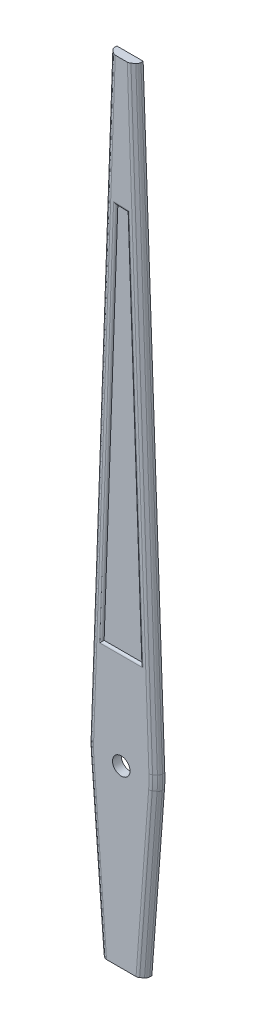
from build123d import *
from OCP.BRepFilletAPI import BRepFilletAPI_MakeChamfer

# Parameters (mm, degrees)
SKETCH_1_R          = 0.2
EXTRUDE_1_DEPTH     = 0.2
CHAMFER_1_SIZE      = 0.1
CHAMFER_1_SIZE2     = 0.127994163
CUT_EXTRUDE_1_DEPTH = 0.05
FILLET_1_R          = 0.1
FILLET_2_R          = 0.05


with BuildPart() as part:
    # Эскиз1 → Бобышка-Вытянуть1 (new body)
    with BuildSketch(Plane.XY):
        with BuildLine():
            Line((-0.794074936, 0.165901801), (-0.3, 14))
            Line((-0.3, 14), (0.3, 14))
            Line((0.3, 14), (0.794074936, 0.165901801))
            ThreePointArc((0.794074936, 0.165901801), (0.795411305, 8.986e-05), (0.787584302, -0.165542636))
            Line((0.787584302, -0.165542636), (0.5, -4))
            Line((0.5, -4), (-0.5, -4))
            Line((-0.5, -4), (-0.787584302, -0.165542636))
            ThreePointArc((-0.787584302, -0.165542636), (-0.795411305, 8.986e-05), (-0.794074936, 0.165901801))
        make_face()
        Circle(SKETCH_1_R, mode=Mode.SUBTRACT)
    extrude(amount=EXTRUDE_1_DEPTH)

    # Фаска1: one chamfer whose edges measure the first distance from different faces: ONE call of the kernel's chamfer builder (chamfer() names one face for all edges)
    chamfer_1_edges_1 = [part.edges().sort_by_distance(p)[0] for p in [
        (-0.795411305, 8.986e-05, 0.2),
    ]]
    chamfer_1_side_1 = [part.faces().sort_by_distance(p)[0] for p in [
        (-0.795411305, 8.986e-05, 0.1),
    ]]
    chamfer_1_edges_2 = [part.edges().sort_by_distance(p)[0] for p in [
        (-0.643792151, -2.082771318, 0.2),
    ]]
    chamfer_1_side_2 = [part.faces().sort_by_distance(p)[0] for p in [
        (-0.643792151, -2.082771318, 0.1),
    ]]
    chamfer_1_edges_3 = [part.edges().sort_by_distance(p)[0] for p in [
        (0.643792151, -2.082771318, 0.2),
    ]]
    chamfer_1_side_3 = [part.faces().sort_by_distance(p)[0] for p in [
        (0.643792151, -2.082771318, 0.1),
    ]]
    chamfer_1_edges_4 = [part.edges().sort_by_distance(p)[0] for p in [
        (0.795411305, 8.986e-05, 0.2),
    ]]
    chamfer_1_side_4 = [part.faces().sort_by_distance(p)[0] for p in [
        (0.795411305, 8.986e-05, 0.1),
    ]]
    chamfer_1_edges_5 = [part.edges().sort_by_distance(p)[0] for p in [
        (0.547037468, 7.0829509, 0.2),
    ]]
    chamfer_1_side_5 = [part.faces().sort_by_distance(p)[0] for p in [
        (0.547037468, 7.0829509, 0.1),
    ]]
    chamfer_1_edges_6 = [part.edges().sort_by_distance(p)[0] for p in [
        (-0.547037468, 7.0829509, 0.2),
    ]]
    chamfer_1_side_6 = [part.faces().sort_by_distance(p)[0] for p in [
        (-0.547037468, 7.0829509, 0.1),
    ]]
    chamfer_1 = BRepFilletAPI_MakeChamfer(part.part.solid().wrapped)
    for e in chamfer_1_edges_1:
        chamfer_1.Add(CHAMFER_1_SIZE, CHAMFER_1_SIZE2, e.wrapped, chamfer_1_side_1[0].wrapped)  # the first distance lies on this face
    for e in chamfer_1_edges_2:
        chamfer_1.Add(CHAMFER_1_SIZE, CHAMFER_1_SIZE2, e.wrapped, chamfer_1_side_2[0].wrapped)  # the first distance lies on this face
    for e in chamfer_1_edges_3:
        chamfer_1.Add(CHAMFER_1_SIZE, CHAMFER_1_SIZE2, e.wrapped, chamfer_1_side_3[0].wrapped)  # the first distance lies on this face
    for e in chamfer_1_edges_4:
        chamfer_1.Add(CHAMFER_1_SIZE, CHAMFER_1_SIZE2, e.wrapped, chamfer_1_side_4[0].wrapped)  # the first distance lies on this face
    for e in chamfer_1_edges_5:
        chamfer_1.Add(CHAMFER_1_SIZE, CHAMFER_1_SIZE2, e.wrapped, chamfer_1_side_5[0].wrapped)  # the first distance lies on this face
    for e in chamfer_1_edges_6:
        chamfer_1.Add(CHAMFER_1_SIZE, CHAMFER_1_SIZE2, e.wrapped, chamfer_1_side_6[0].wrapped)  # the first distance lies on this face
    add(Compound.cast(chamfer_1.Shape()), mode=Mode.REPLACE)

    # Эскиз2 → Вырез-Вытянуть1 (cut)
    with BuildSketch(Plane.XY.offset(0.2)):
        Polygon((-0.127832554, 11.03188933), (-0.441828601, 2.24), (0.441828601, 2.24), (0.128159074, 11.022746772), align=None)
    extrude(amount=-CUT_EXTRUDE_1_DEPTH, mode=Mode.SUBTRACT)

    # Скругление1
    fillet_1_edges = [part.edges().sort_by_distance(p)[0] for p in [
        (-0.419043279, 7.080666746, 0.2),
        (-0.667441677, 0.002595872, 0.2),
        (-0.515797485, -2.077984979, 0.2),
        (0.419043279, 7.080666746, 0.2),
        (0.667441677, 0.002595872, 0.2),
        (0.515797485, -2.077984979, 0.2),
        (0.643792151, -2.082771318, 0.1),
        (0.795411305, 8.986e-05, 0.1),
        (0.547037468, 7.0829509, 0.1),
        (-0.643792151, -2.082771318, 0.1),
        (-0.795411305, 8.986e-05, 0.1),
        (-0.547037468, 7.0829509, 0.1),
    ]]
    fillet(fillet_1_edges, radius=FILLET_1_R)

    # Скругление2
    fillet_2_edges = [part.edges().sort_by_distance(p)[0] for p in [
        (0.00016326, 11.027318051, 0.2),
        (0.284993837, 6.631373386, 0.2),
        (0, 2.24, 0.2),
        (-0.284830577, 6.635944665, 0.2),
    ]]
    fillet(fillet_2_edges, radius=FILLET_2_R - 0.0001)  # a hair under: the kernel refuses the full size


solid = part.part
